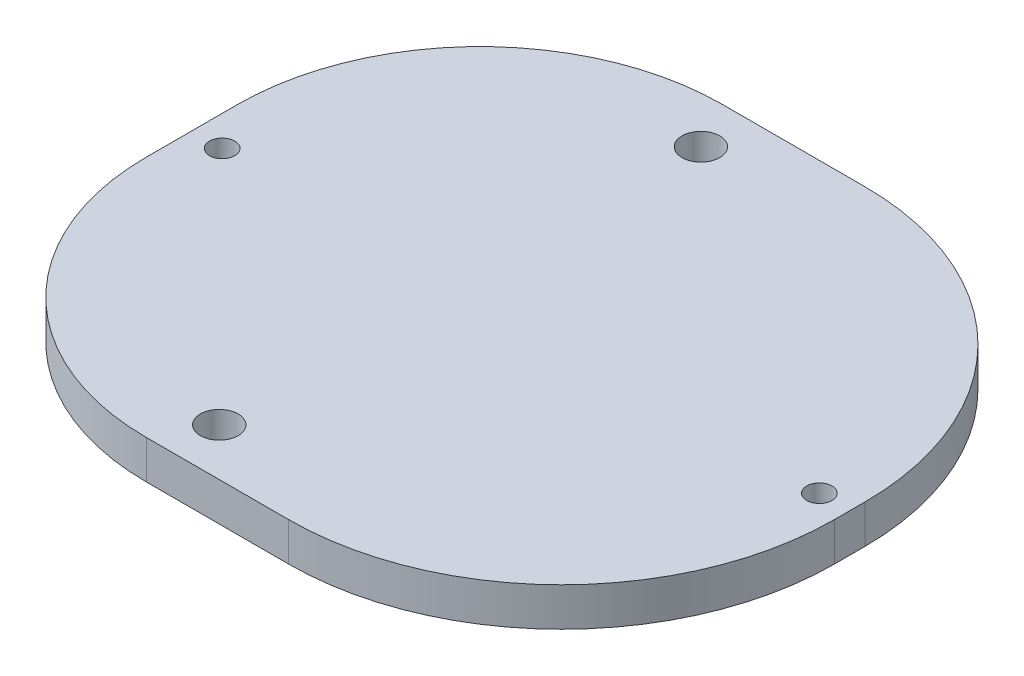
from build123d import *

# Parameters (mm, degrees)
SKETCH1_R           = 2.0828
SKETCH1_R_2         = 3.11
BOSS_EXTRUDE1_DEPTH = 6.35


with BuildPart() as part:
    # Sketch1 → Boss-Extrude1 (new body)
    with BuildSketch(Plane(origin=(0, 0, 0), x_dir=(1, 0, 0), z_dir=(0, 1, 0))):
        with BuildLine():
            Line((-14.2125, -47.5), (9.2125, -47.5))
            ThreePointArc((9.2125, -47.5), (41.032305153, -34.319805153), (54.2125, -2.5))
            Line((54.2125, -2.5), (54.2125, 2.5))
            ThreePointArc((54.2125, 2.5), (41.032305153, 34.319805153), (9.2125, 47.5))
            Line((9.2125, 47.5), (-14.2125, 47.5))
            ThreePointArc((-14.2125, 47.5), (-42.496771247, 35.784271247), (-54.2125, 7.5))
            Line((-54.2125, 7.5), (-54.2125, -7.5))
            ThreePointArc((-54.2125, -7.5), (-42.496771247, -35.784271247), (-14.2125, -47.5))
        make_face()
        with Locations((-49.2125, 0)):
            Circle(SKETCH1_R, mode=Mode.SUBTRACT)
        with Locations((49.2125, 0)):
            Circle(SKETCH1_R, mode=Mode.SUBTRACT)
        with Locations((-10, -39.6875)):
            Circle(SKETCH1_R_2, mode=Mode.SUBTRACT)
        with Locations((-10, 39.6875)):
            Circle(SKETCH1_R_2, mode=Mode.SUBTRACT)
    extrude(amount=BOSS_EXTRUDE1_DEPTH)


solid = part.part
